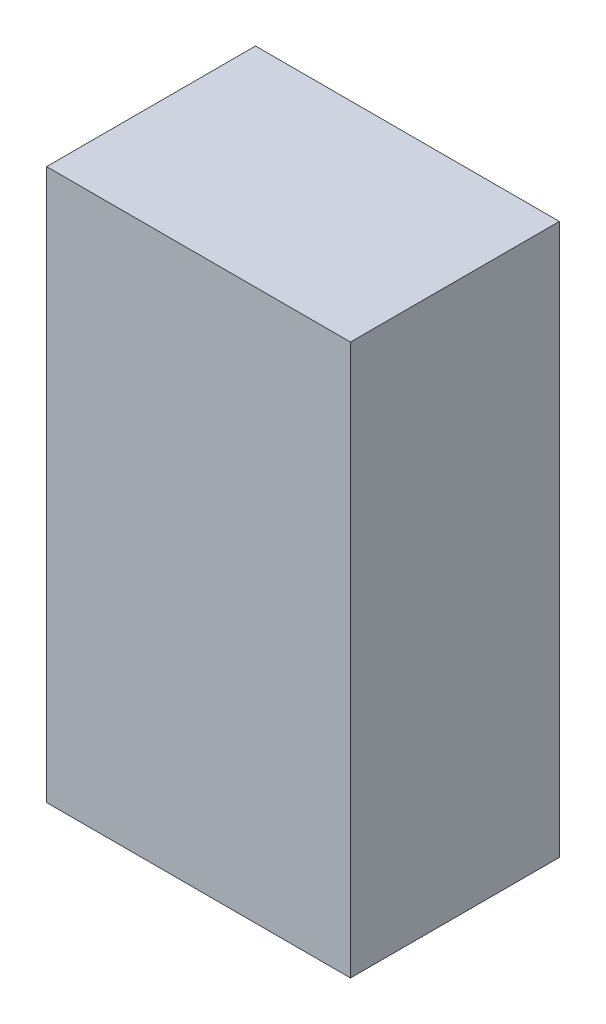
from build123d import *

# Parameters (mm, degrees)
SKETCH1_W           = 50.8
SKETCH1_H           = 34.925
BOSS_EXTRUDE1_DEPTH = 92.075


with BuildPart() as part:
    # Sketch1 → Boss-Extrude1 (new body)
    with BuildSketch(Plane(origin=(0, 0, 0), x_dir=(1, 0, 0), z_dir=(0, 1, 0))):
        with Locations((25.4, 17.4625)):
            Rectangle(SKETCH1_W, SKETCH1_H)
    extrude(amount=BOSS_EXTRUDE1_DEPTH)


solid = part.part
